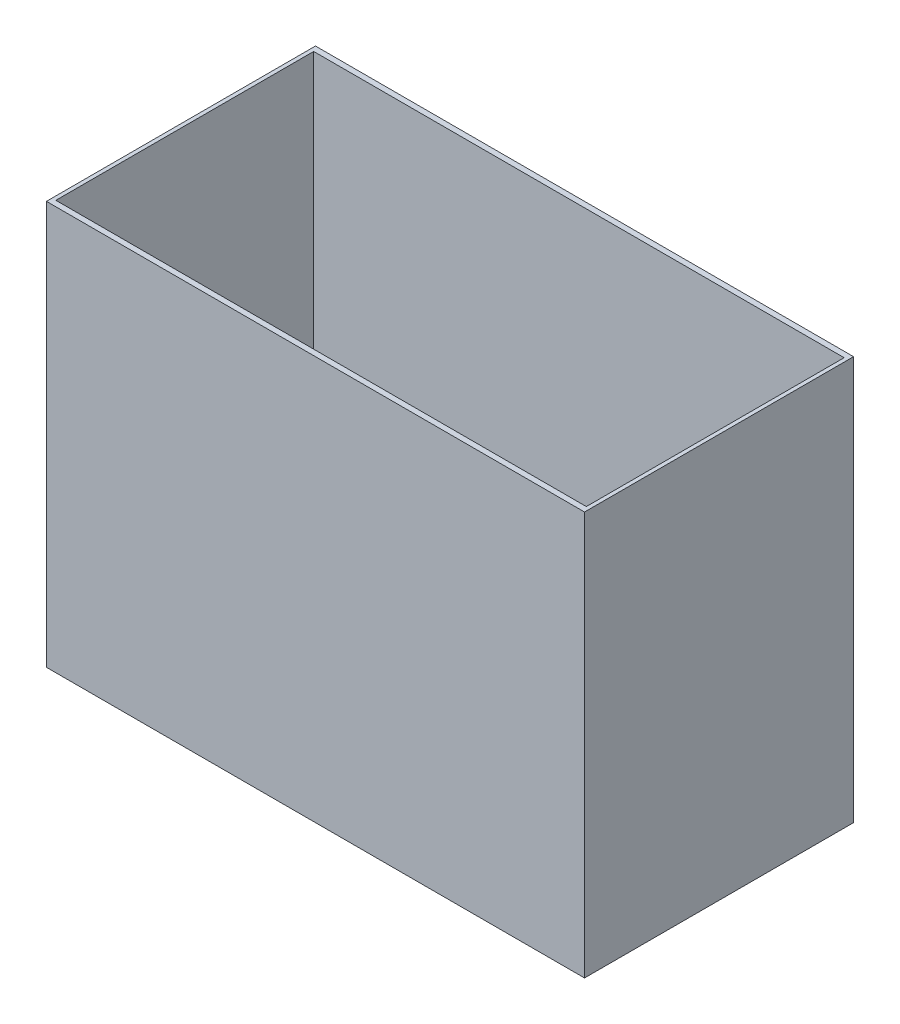
from build123d import *

# Parameters (mm, degrees)
SKETCH1_W           = 584.2
SKETCH1_H           = 279.4
BOSS_EXTRUDE1_DEPTH = 12.7
SKETCH3_W           = 609.6
SKETCH3_H           = 304.8
SKETCH3_W_2         = 600.964
SKETCH3_H_2         = 292.1
BOSS_EXTRUDE3_DEPTH = 457.2
SKETCH4_R           = 2.778125
CUT_EXTRUDE1_DEPTH  = 561.097357608
SKETCH6_R           = 6.35
CUT_EXTRUDE2_DEPTH  = 2.54
SKETCH7_R           = 2.778125
CUT_EXTRUDE3_DEPTH  = 561.097357608
SKETCH8_R           = 1.984375
CUT_EXTRUDE4_DEPTH  = 561.097357608
SKETCH9_R           = 6.35
CUT_EXTRUDE5_DEPTH  = 3.175


with BuildPart() as part:
    # Sketch1 → Boss-Extrude1 (new body)
    with BuildSketch(Plane(origin=(0, 0, 0), x_dir=(1, 0, 0), z_dir=(0, 1, 0))):
        Rectangle(SKETCH1_W, SKETCH1_H)
    extrude(amount=BOSS_EXTRUDE1_DEPTH)

    # Sketch4 → Cut-Extrude1 (cut, through all)
    with BuildSketch(Plane(origin=(0, 12.7, 0), x_dir=(1, 0, 0), z_dir=(0, 1, 0))):
        with Locations((254, 101.6)):
            Circle(SKETCH4_R)
    cut_extrude1 = extrude(amount=-CUT_EXTRUDE1_DEPTH, mode=Mode.SUBTRACT)

    # Sketch6 → Cut-Extrude2 (cut)
    with BuildSketch(Plane.XZ):
        with Locations((254, -101.6)):
            Circle(SKETCH6_R)
    cut_extrude2 = extrude(amount=-CUT_EXTRUDE2_DEPTH, mode=Mode.SUBTRACT)

    # Mirror1: Cut-Extrude1, Cut-Extrude2 across plane
    add(cut_extrude1.mirror(Plane.XY), mode=Mode.SUBTRACT)
    add(cut_extrude2.mirror(Plane.XY), mode=Mode.SUBTRACT)

    # Sketch7 → Cut-Extrude3 (cut, through all)
    with BuildSketch(Plane(origin=(0, 12.7, 0), x_dir=(1, 0, 0), z_dir=(0, 1, 0))):
        with Locations((190.5, 0)):
            Circle(SKETCH7_R)
    extrude(amount=-CUT_EXTRUDE3_DEPTH, mode=Mode.SUBTRACT)

    # Sketch8 → Cut-Extrude4 (cut, through all)
    with BuildSketch(Plane(origin=(0, 12.7, 0), x_dir=(1, 0, 0), z_dir=(0, 1, 0))):
        with Locations((94.9, -12.8415)):
            Circle(SKETCH8_R)
        with Locations((146.1, -12.8415)):
            Circle(SKETCH8_R)
        with Locations((146.1, 12.8415)):
            Circle(SKETCH8_R)
        with Locations((94.9, 12.8415)):
            Circle(SKETCH8_R)
    extrude(amount=-CUT_EXTRUDE4_DEPTH, mode=Mode.SUBTRACT)

    # Sketch9 → Cut-Extrude5 (cut)
    with BuildSketch(Plane.XZ):
        with Locations((190.5, 0)):
            Circle(SKETCH9_R)
        with Locations((146.1, 12.8415)):
            Circle(SKETCH9_R)
        with Locations((94.9, 12.8415)):
            Circle(SKETCH9_R)
        with Locations((94.9, -12.8415)):
            Circle(SKETCH9_R)
        with Locations((146.1, -12.8415)):
            Circle(SKETCH9_R)
    extrude(amount=-CUT_EXTRUDE5_DEPTH, mode=Mode.SUBTRACT)


with BuildPart() as body_2:
    # Sketch3 → Boss-Extrude3 (new body)
    with BuildSketch(Plane(origin=(0, 0, 0), x_dir=(1, 0, 0), z_dir=(0, 1, 0))):
        Rectangle(SKETCH3_W, SKETCH3_H)
        Rectangle(SKETCH3_W_2, SKETCH3_H_2, mode=Mode.SUBTRACT)
    extrude(amount=BOSS_EXTRUDE3_DEPTH)


solid = Compound([part.part, body_2.part])
